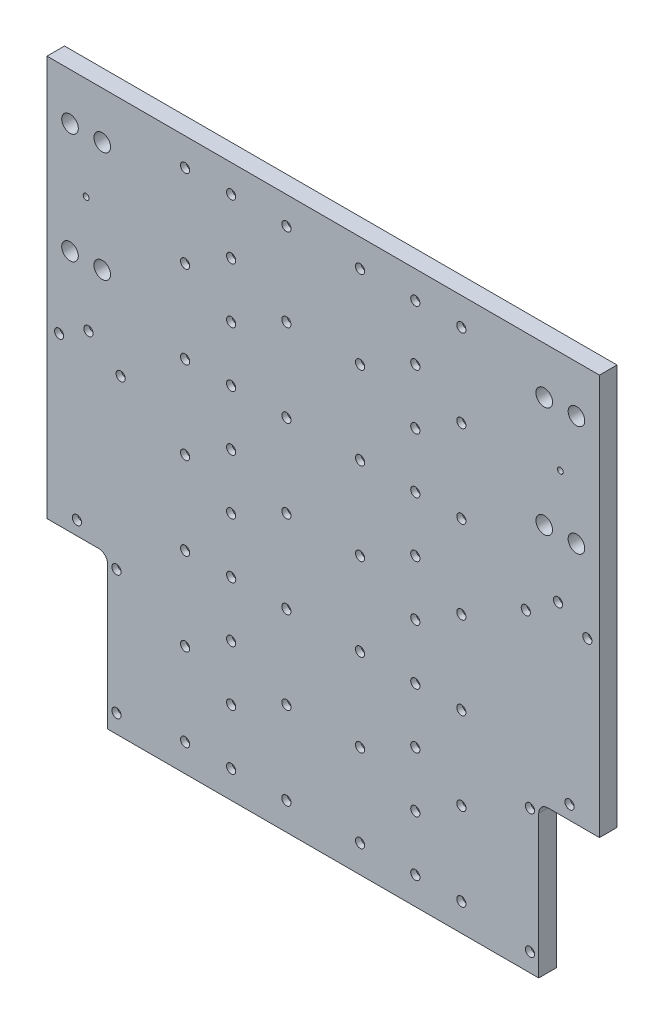
from build123d import *

# Parameters (mm, degrees)
SKETCH1_W                      = 600
SKETCH1_H                      = 600
BOSS_EXTRUDE1_DEPTH            = 19.05
SKETCH2_W                      = 65.95
SKETCH2_H                      = 165
CUT_EXTRUDE1_DEPTH             = 425.69153806
FILLET1_R                      = 10
SKETCH5_R                      = 9.017
SKETCH5_R_2                    = 3.175
CUT_EXTRUDE2_DEPTH             = 425.69153806
CBORE_FOR_M5_SHCS1_D           = 5.5
CBORE_FOR_M5_SHCS1_DEPTH       = 28.347633298
CBORE_FOR_M5_SHCS1_CBORE_D     = 10
CBORE_FOR_M5_SHCS1_CBORE_DEPTH = 6
CBORE_FOR_M5_SHCS1_TIP         = 1.652366702


with BuildPart() as part:
    # Sketch1 → Boss-Extrude1 (new body)
    with BuildSketch(Plane.XY):
        Rectangle(SKETCH1_W, SKETCH1_H)
    extrude(amount=BOSS_EXTRUDE1_DEPTH)

    # Sketch2 → Cut-Extrude1 (cut, through all)
    with BuildSketch(Plane(origin=(0, 0, 0), x_dir=(-1, 0, 0), z_dir=(0, 0, -1))):
        with Locations((267.025, -217.5)):
            Rectangle(SKETCH2_W, SKETCH2_H)
        with Locations((-267.025, -217.5)):
            Rectangle(SKETCH2_W, SKETCH2_H)
    extrude(amount=-CUT_EXTRUDE1_DEPTH, mode=Mode.SUBTRACT)

    # Fillet1
    fillet1_edges = [part.edges().sort_by_distance(p)[0] for p in [
        (-234.05, -135, 9.525),
        (234.05, -135, 9.525),
    ]]
    fillet(fillet1_edges, radius=FILLET1_R)

    # Sketch5 → Cut-Extrude2 (cut, through all)
    with BuildSketch(Plane(origin=(0, 0, 0), x_dir=(-1, 0, 0), z_dir=(0, 0, -1))):
        with Locations((240, 249)):
            Circle(SKETCH5_R)
        with Locations((275, 249)):
            Circle(SKETCH5_R)
        with Locations((257.5, 189)):
            Circle(SKETCH5_R_2)
        with Locations((275, 129)):
            Circle(SKETCH5_R)
        with Locations((240, 129)):
            Circle(SKETCH5_R)
        with Locations((-275, 129)):
            Circle(SKETCH5_R)
        with Locations((-240, 129)):
            Circle(SKETCH5_R)
        with Locations((-257.5, 189)):
            Circle(SKETCH5_R_2)
        with Locations((-275, 249)):
            Circle(SKETCH5_R)
        with Locations((-240, 249)):
            Circle(SKETCH5_R)
    extrude(amount=-CUT_EXTRUDE2_DEPTH, mode=Mode.SUBTRACT)

    # CBORE for M5 SHCS1
    with Locations(Plane.XY.offset(19.05)):
        with Locations((-100, 210), (-100, 270), (100, 270), (100, 210), (100, 150), (-100, 150), (-100, 90), (100, 90), (100, 30), (-100, 30), (-255, 64), (-220, 39), (255, 64), (220, 39), (100, -30), (-100, -30), (-100, -90), (100, -90), (100, -150), (-100, -150), (-100, -210), (100, -210), (100, -270), (-100, -270), (150, -270), (150, -180), (150, -90), (150, 0), (150, 90), (150, 180), (150, 270), (40, 270), (40, 180), (-40, 180), (-40, 270), (-150, 270), (-150, 180), (-150, 90), (-40, 90), (40, 90), (40, 0), (-40, 0), (-40, -90), (40, -90), (-150, -90), (-150, 0), (-150, -180), (-150, -270), (-40, -270), (-40, -180), (40, -180), (40, -270), (224.525, -280), (224.525, -145), (-224.525, -145), (-224.525, -280), (-267.5, -120), (-286.823374453, 45.715728753), (286.823374453, 45.715728753), (267.5, -120)):
            CounterBoreHole(CBORE_FOR_M5_SHCS1_D / 2, CBORE_FOR_M5_SHCS1_CBORE_D / 2, CBORE_FOR_M5_SHCS1_CBORE_DEPTH, depth=CBORE_FOR_M5_SHCS1_DEPTH)
            with Locations((0, 0, -(CBORE_FOR_M5_SHCS1_DEPTH + CBORE_FOR_M5_SHCS1_TIP / 2))):  # 118° drill point
                Cone(0, CBORE_FOR_M5_SHCS1_D / 2, CBORE_FOR_M5_SHCS1_TIP, mode=Mode.SUBTRACT)


solid = part.part
